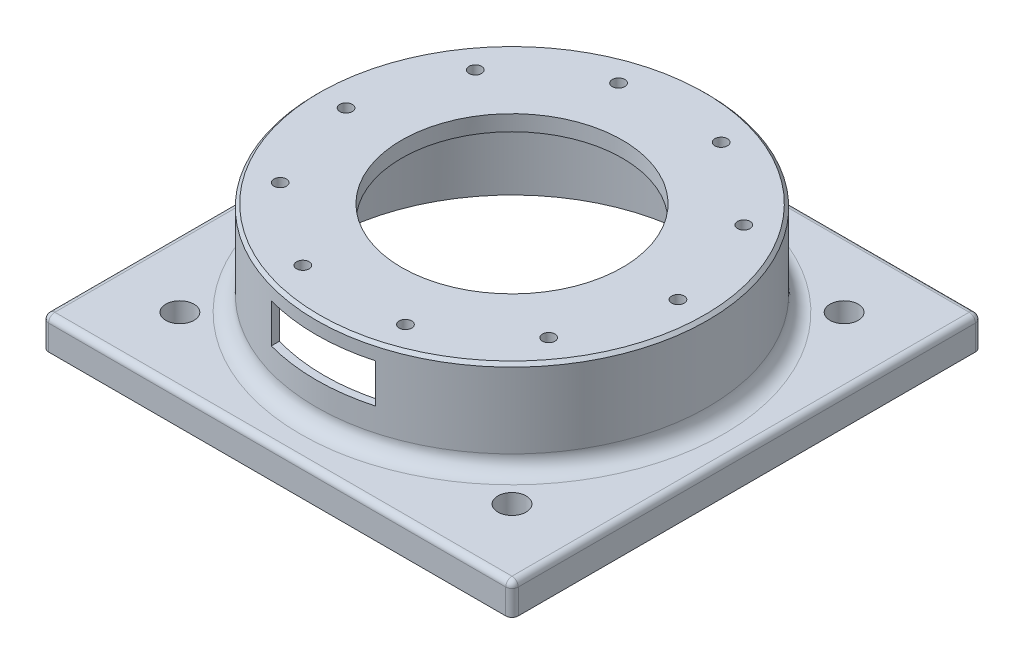
from build123d import *

# Parameters (mm, degrees)
SKETCH_1_W          = 150
SKETCH_1_H          = 150
SKETCH_1_R          = 4.5
EXTRUDE_1_DEPTH     = 10
FILLET_1_R          = 2
FILLET_2_R          = 2
SKETCH_4_R          = 62.5
EXTRUDE_4_DEPTH     = 30
FILLET_5_R          = 5
SKETCH_11_R         = 35.25
CUT_EXTRUDE_2_DEPTH = 114.357840488
SKETCH_10_R         = 60
CUT_EXTRUDE_3_DEPTH = 35
SKETCH_12_R         = 2
CUT_EXTRUDE_4_DEPTH = 114.357840488
CHAMFER_2_SIZE      = 1
SKETCH_14_W         = 33.25
SKETCH_14_H         = 12.5
CUT_EXTRUDE_5_DEPTH = 5


with BuildPart() as part:
    # Эскиз1 → Бобышка-Вытянуть1 (new body)
    with BuildSketch(Plane(origin=(0, 0, 0), x_dir=(1, 0, 0), z_dir=(0, 1, 0))):
        Rectangle(SKETCH_1_W, SKETCH_1_H)
        with Locations((53.033008589, 53.033008589)):
            Circle(SKETCH_1_R, mode=Mode.SUBTRACT)
        with Locations((53.033008589, -53.033008589)):
            Circle(SKETCH_1_R, mode=Mode.SUBTRACT)
        with Locations((-53.033008589, -53.033008589)):
            Circle(SKETCH_1_R, mode=Mode.SUBTRACT)
        with Locations((-53.033008589, 53.033008589)):
            Circle(SKETCH_1_R, mode=Mode.SUBTRACT)
    extrude(amount=EXTRUDE_1_DEPTH)

    # Скругление1
    fillet_1_edges = [part.edges().sort_by_distance(p)[0] for p in [
        (-75, 5, -75),
        (75, 5, -75),
        (-75, 5, 75),
        (75, 5, 75),
    ]]
    fillet(fillet_1_edges, radius=FILLET_1_R)

    # Скругление2
    fillet_2_edges = [part.edges().sort_by_distance(p)[0] for p in [
        (-74.414213562, 10, -74.414213562),
        (74.414213562, 10, -74.414213562),
        (74.414213562, 10, 74.414213562),
        (-74.414213562, 10, 74.414213562),
        (0, 10, 75),
        (75, 10, 0),
        (0, 10, -75),
        (-75, 10, 0),
    ]]
    fillet(fillet_2_edges, radius=FILLET_2_R)

    # Эскиз4 → Бобышка-Вытянуть4 (add)
    with BuildSketch(Plane(origin=(0, 10, 0), x_dir=(1, 0, 0), z_dir=(0, 1, 0))):
        Circle(SKETCH_4_R)
    extrude(amount=EXTRUDE_4_DEPTH)

    # Скругление5
    fillet_5_edges = [part.edges().sort_by_distance(p)[0] for p in [
        (-62.5, 10, 0),
    ]]
    fillet(fillet_5_edges, radius=FILLET_5_R)

    # Эскиз11 → Вырез-Вытянуть2 (cut, through all)
    with BuildSketch(Plane(origin=(0, 40, 0), x_dir=(1, 0, 0), z_dir=(0, 1, 0))):
        Circle(SKETCH_11_R)
    extrude(amount=-CUT_EXTRUDE_2_DEPTH, mode=Mode.SUBTRACT)

    # Эскиз10 → Вырез-Вытянуть3 (cut)
    with BuildSketch(Plane.XZ):
        Circle(SKETCH_10_R)
    extrude(amount=-CUT_EXTRUDE_3_DEPTH, mode=Mode.SUBTRACT)

    # Эскиз12 → Вырез-Вытянуть4 (cut, through all)
    with BuildSketch(Plane(origin=(0, 40, 0), x_dir=(1, 0, 0), z_dir=(0, 1, 0))):
        with Locations((-53, 0)):
            Circle(SKETCH_12_R)
        with Locations((-42.877900702, 31.152618372)):
            Circle(SKETCH_12_R)
        with Locations((-16.377900702, 50.405995364)):
            Circle(SKETCH_12_R)
        with Locations((16.377900702, 50.405995364)):
            Circle(SKETCH_12_R)
        with Locations((42.877900702, 31.152618372)):
            Circle(SKETCH_12_R)
        with Locations((53, 0)):
            Circle(SKETCH_12_R)
        with Locations((42.877900702, -31.152618372)):
            Circle(SKETCH_12_R)
        with Locations((16.377900702, -50.405995364)):
            Circle(SKETCH_12_R)
        with Locations((-16.377900702, -50.405995364)):
            Circle(SKETCH_12_R)
        with Locations((-42.877900702, -31.152618372)):
            Circle(SKETCH_12_R)
    extrude(amount=-CUT_EXTRUDE_4_DEPTH, mode=Mode.SUBTRACT)

    # Фаска2
    chamfer_2_edges = [part.edges().sort_by_distance(p)[0] for p in [
        (-62.5, 40, 0),
    ]]
    chamfer(chamfer_2_edges, length=CHAMFER_2_SIZE)

    # Эскиз14 → Вырез-Вытянуть5 (cut)
    with BuildSketch(Plane.XY.offset(62.5)):
        with Locations((0, 28.75)):
            Rectangle(SKETCH_14_W, SKETCH_14_H)
    extrude(amount=-CUT_EXTRUDE_5_DEPTH, mode=Mode.SUBTRACT)


solid = part.part
